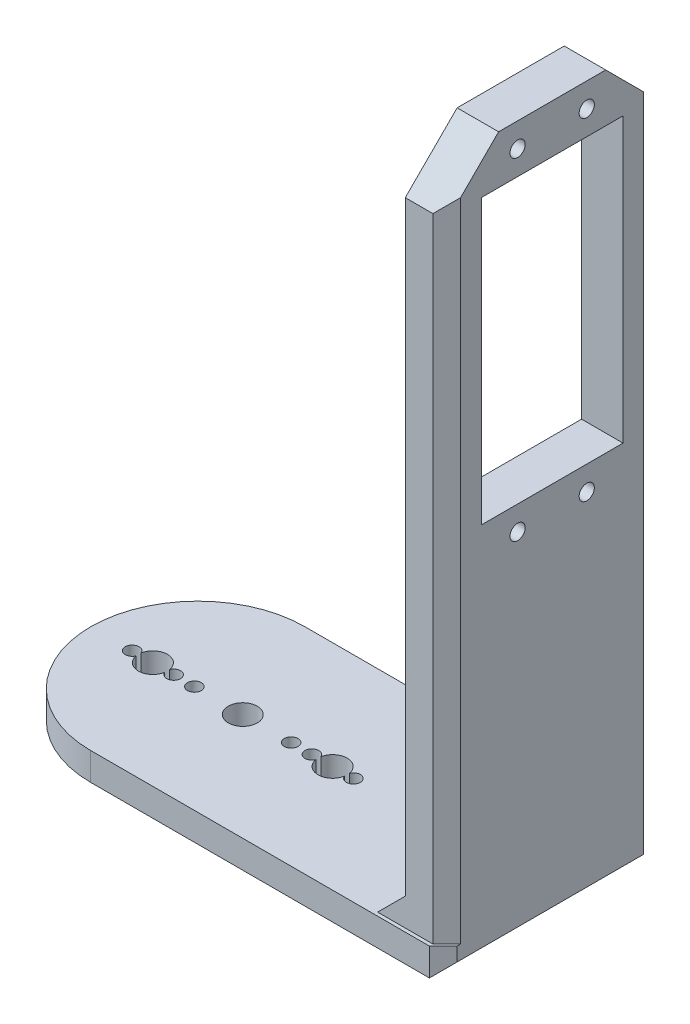
from build123d import *

# Parameters (mm, degrees)
CROQUIS1_W              = 44
CROQUIS1_H              = 31
CROQUIS1_R              = 1
CROQUIS1_R_2            = 2.1
SALIENTE_EXTRUIR1_DEPTH = 6
CROQUIS2_W              = 31
CROQUIS2_H              = 6
SALIENTE_EXTRUIR2_DEPTH = 16.5
CROQUIS3_R              = 1.1
CROQUIS3_W              = 20.5
CROQUIS3_H              = 41
SALIENTE_EXTRUIR3_DEPTH = 6
CROQUIS4_R              = 2.1
CROQUIS4_R_2            = 1
SALIENTE_EXTRUIR4_DEPTH = 2
CROQUIS5_R              = 2.1
CORTAR_EXTRUIR1_DEPTH   = 3.5
REDONDEO1_R             = 15.5
CHAFL_N1_SIZE           = 2
CHAFL_N2_SIZE           = 2
CHAFL_N3_SIZE           = 4
CHAFL_N4_SIZE           = 4
CHAFL_N5_SIZE           = 7.5


with BuildPart() as part:
    # Croquis1 → Saliente-Extruir1 (new body)
    with BuildSketch(Plane(origin=(0, 0, 0), x_dir=(1, 0, 0), z_dir=(0, 1, 0))):
        Rectangle(CROQUIS1_W, CROQUIS1_H)
        with Locations(Location((13, 0, 0), (0, 0, 270))):
            Circle(CROQUIS1_R, mode=Mode.SUBTRACT)
        with Locations(Location((0, 0, 0), (0, 0, 270))):
            Circle(CROQUIS1_R_2, mode=Mode.SUBTRACT)
        with Locations(Location((7, 0, 0), (0, 0, 270))):
            Circle(CROQUIS1_R, mode=Mode.SUBTRACT)
        with Locations(Location((-7, 0, 0), (0, 0, 270))):
            Circle(CROQUIS1_R, mode=Mode.SUBTRACT)
        with Locations(Location((-10, 0, 0), (0, 0, 270))):
            Circle(CROQUIS1_R, mode=Mode.SUBTRACT)
        with Locations(Location((-13, 0, 0), (0, 0, 270))):
            Circle(CROQUIS1_R, mode=Mode.SUBTRACT)
        with Locations(Location((-16, 0, 0), (0, 0, 270))):
            Circle(CROQUIS1_R, mode=Mode.SUBTRACT)
        with Locations(Location((10, 0, 0), (0, 0, 270))):
            Circle(CROQUIS1_R, mode=Mode.SUBTRACT)
        with Locations(Location((16, 0, 0), (0, 0, 270))):
            Circle(CROQUIS1_R, mode=Mode.SUBTRACT)
    extrude(amount=SALIENTE_EXTRUIR1_DEPTH)

    # Croquis2 → Saliente-Extruir2 (add)
    with BuildSketch(Plane(origin=(22, 0, 0), x_dir=(0, 0, -1), z_dir=(1, 0, 0))):
        with Locations((0, 3)):
            Rectangle(CROQUIS2_W, CROQUIS2_H)
    extrude(amount=SALIENTE_EXTRUIR2_DEPTH)

    # Croquis3 → Saliente-Extruir3 (add)
    with BuildSketch(Plane(origin=(38.5, 0, 0), x_dir=(0, 0, -1), z_dir=(1, 0, 0))):
        Polygon((15.5, 105), (-14.991801075, 105), (-14.991801075, 6), (-15.5, 6), (-15.5, 0), (15.5, 0), align=None)
        with Locations((-4.741801075, 53.5)):
            Circle(CROQUIS3_R, mode=Mode.SUBTRACT)
        with Locations((-4.741801075, 101.5)):
            Circle(CROQUIS3_R, mode=Mode.SUBTRACT)
        with Locations((5.258198925, 53.5)):
            Circle(CROQUIS3_R, mode=Mode.SUBTRACT)
        with Locations((0.258198925, 77.5)):
            Rectangle(CROQUIS3_W, CROQUIS3_H, mode=Mode.SUBTRACT)
        with Locations((5.258198925, 101.5)):
            Circle(CROQUIS3_R, mode=Mode.SUBTRACT)
    extrude(amount=SALIENTE_EXTRUIR3_DEPTH)

    # Croquis4 → Saliente-Extruir4 (add)
    with BuildSketch(Plane.XZ):
        with Locations(Location((0, 0, 0), (0, 0, 270))):
            Circle(CROQUIS4_R)
        with Locations(Location((0, 0, 0), (0, 0, 270))):
            Circle(CROQUIS4_R_2, mode=Mode.SUBTRACT)
    extrude(amount=-SALIENTE_EXTRUIR4_DEPTH)

    # Croquis5 → Cortar-Extruir1 (cut)
    with BuildSketch(Plane(origin=(0, 6, 0), x_dir=(1, 0, 0), z_dir=(0, 1, 0))):
        with Locations((-13, 0)):
            Circle(CROQUIS5_R)
        with Locations((13, 0)):
            Circle(CROQUIS5_R)
    extrude(amount=-CORTAR_EXTRUIR1_DEPTH, mode=Mode.SUBTRACT)

    # Redondeo1
    redondeo1_edges = [part.edges().sort_by_distance(p)[0] for p in [
        (-22, 3, 15.5),
        (-22, 3, -15.5),
    ]]
    fillet(redondeo1_edges, radius=REDONDEO1_R - 0.0001)  # a hair under: the kernel refuses the full size

    # Chaflán1
    chafl_n1_edges = [part.edges().sort_by_distance(p)[0] for p in [
        (18.99995, 0, 15.5),
        (18.99995, 0, -15.5),
        (-17.460184398, 0, -10.960184398),
        (-17.460184398, 0, 10.960184398),
        (44.5, 52.5, -15.5),
        (44.5, 55.5, 14.991801075),
    ]]
    chamfer(chafl_n1_edges, length=CHAFL_N1_SIZE)

    # Chaflán2
    chafl_n2_edges = [part.edges().sort_by_distance(p)[0] for p in [
        (44.5, 4, 15.5),
    ]]
    chamfer(chafl_n2_edges, length=CHAFL_N2_SIZE)

    # Chaflán3
    chafl_n3_edges = [part.edges().sort_by_distance(p)[0] for p in [
        (44.5, 0, 0),
    ]]
    chamfer(chafl_n3_edges, length=CHAFL_N3_SIZE - 0.0001)  # a hair under: the kernel refuses the full size

    # Chaflán4
    chafl_n4_edges = [part.edges().sort_by_distance(p)[0] for p in [
        (38.5, 6, -0.254099463),
    ]]
    chamfer(chafl_n4_edges, length=CHAFL_N4_SIZE)

    # Chaflán5
    chafl_n5_edges = [part.edges().sort_by_distance(p)[0] for p in [
        (40.5, 105, 14.991801075),
        (40.5, 105, -15.5),
    ]]
    chamfer(chafl_n5_edges, length=CHAFL_N5_SIZE)


solid = part.part
